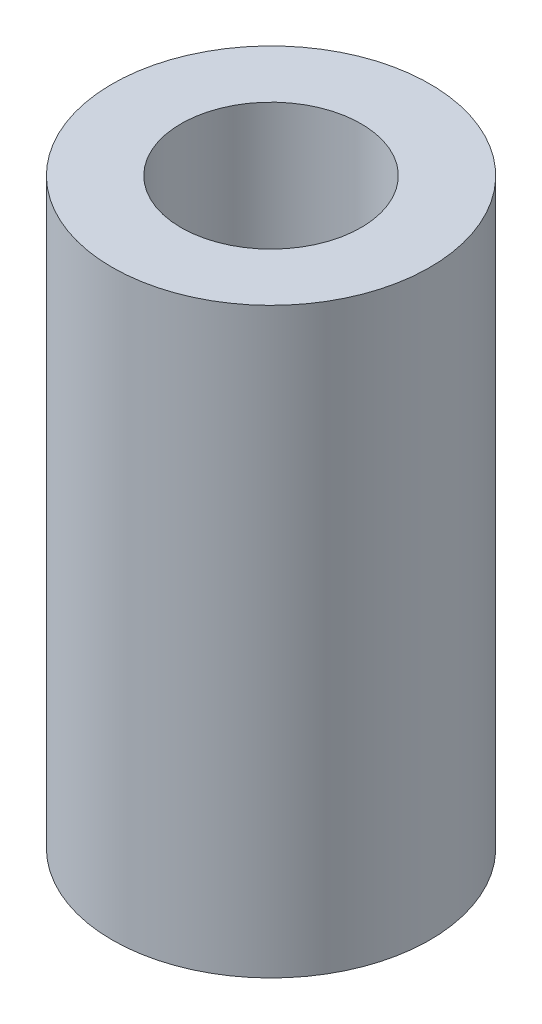
from build123d import *

# Parameters (mm, degrees)
SKETCH2_R            = 3
BOSS_EXTRUDE1_DEPTH  = 5.5
M3_CLEARANCE_HOLE1_D = 3.4


with BuildPart() as part:
    # Sketch2 → Boss-Extrude1 (new, symmetric)
    with BuildSketch(Plane(origin=(0, 0, 0), x_dir=(1, 0, 0), z_dir=(0, 1, 0))):
        Circle(SKETCH2_R)
    extrude(amount=BOSS_EXTRUDE1_DEPTH, both=True)

    # M3 Clearance Hole1 (through all)
    with Locations(Plane(origin=(0, 5.5, 0), x_dir=(1, 0, 0), z_dir=(0, 1, 0))):
        with Locations((0, 0)):
            Hole(M3_CLEARANCE_HOLE1_D / 2)


solid = part.part
